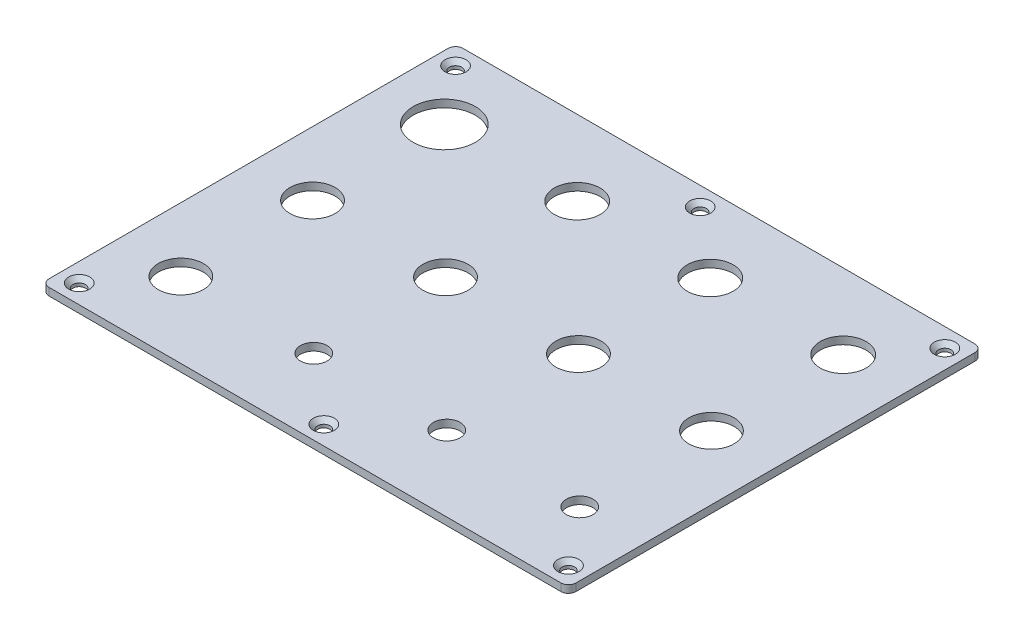
from build123d import *

# Parameters (mm, degrees)
BOTTOM_PLATE_W                       = 140
BOTTOM_PLATE_H                       = 110
BOTTOM_PLATE_EXT_DEPTH               = 2
MIDDLE_ROW_R                         = 6
MIDDLE_ROW_CUT_DEPTH                 = 179.056170912
TOP_ROW_R                            = 8.25
TOP_ROW_R_2                          = 6.1
TOP_ROW_CUT_DEPTH                    = 179.056170912
BOTTOM_ROW_R                         = 3.55
BOTTOM_ROW_R_2                       = 6
BOTTOM_ROW_CUT_DEPTH                 = 179.056170912
PLATE_SCREWS_R                       = 1.65
PLATE_SCREWS_CUT_DEPTH               = 179.056170912
PLATE_SCREW_HEAD_R                   = 2.8
PLATE_SCREW_HEAD_CUT_DEPTH           = 2
PLATE_SCREW_HEAD_CUT_DRAFT           = -45
PLATE_SCREW_HEAD_CUT_PROFILE_2_DEPTH = 2
PLATE_SCREW_HEAD_CUT_PROFILE_2_DRAFT = -45
PLATE_SCREW_HEAD_CUT_PROFILE_3_DEPTH = 2
PLATE_SCREW_HEAD_CUT_PROFILE_3_DRAFT = -45
PLATE_SCREW_HEAD_CUT_PROFILE_4_DEPTH = 2
PLATE_SCREW_HEAD_CUT_PROFILE_4_DRAFT = -45
PLATE_SCREW_HEAD_CUT_PROFILE_5_DEPTH = 2
PLATE_SCREW_HEAD_CUT_PROFILE_5_DRAFT = -45
PLATE_SCREW_HEAD_CUT_PROFILE_6_DEPTH = 2
PLATE_SCREW_HEAD_CUT_PROFILE_6_DRAFT = -45
FILLET1_R                            = 2
FILLET2_R                            = 2
FILLET3_R                            = 2
FILLET4_R                            = 2


with BuildPart() as part:
    # Bottom Plate → Bottom Plate EXT (new body)
    with BuildSketch(Plane(origin=(0, 0, 0), x_dir=(1, 0, 0), z_dir=(0, 1, 0))):
        with Locations((-70, 55)):
            Rectangle(BOTTOM_PLATE_W, BOTTOM_PLATE_H)
    extrude(amount=BOTTOM_PLATE_EXT_DEPTH)

    # Middle Row → Middle Row Cut (cut, through all)
    with BuildSketch(Plane(origin=(0, 2, 0), x_dir=(1, 0, 0), z_dir=(0, 1, 0))):
        with Locations((-123, 55)):
            Circle(MIDDLE_ROW_R)
        with Locations((-87.666666667, 55)):
            Circle(MIDDLE_ROW_R)
        with Locations((-52.333333333, 55)):
            Circle(MIDDLE_ROW_R)
        with Locations((-17, 55)):
            Circle(MIDDLE_ROW_R)
    extrude(amount=-MIDDLE_ROW_CUT_DEPTH, mode=Mode.SUBTRACT)

    # Top Row → Top Row Cut (cut, through all)
    with BuildSketch(Plane(origin=(0, 2, 0), x_dir=(1, 0, 0), z_dir=(0, 1, 0))):
        with Locations((-123, 90)):
            Circle(TOP_ROW_R)
        with Locations((-87.666666667, 90)):
            Circle(TOP_ROW_R_2)
        with Locations((-52.333333333, 90)):
            Circle(TOP_ROW_R_2)
        with Locations((-17, 90)):
            Circle(TOP_ROW_R_2)
    extrude(amount=-TOP_ROW_CUT_DEPTH, mode=Mode.SUBTRACT)

    # Bottom Row → Bottom Row Cut (cut, through all)
    with BuildSketch(Plane(origin=(0, 2, 0), x_dir=(1, 0, 0), z_dir=(0, 1, 0))):
        with Locations((-87.666666667, 20)):
            Circle(BOTTOM_ROW_R)
        with Locations((-52.333333333, 20)):
            Circle(BOTTOM_ROW_R)
        with Locations((-17, 20)):
            Circle(BOTTOM_ROW_R)
        with Locations((-123, 20)):
            Circle(BOTTOM_ROW_R_2)
    extrude(amount=-BOTTOM_ROW_CUT_DEPTH, mode=Mode.SUBTRACT)

    # Plate Screws → Plate Screws Cut (cut, through all)
    with BuildSketch(Plane(origin=(0, 2, 0), x_dir=(1, 0, 0), z_dir=(0, 1, 0))):
        with Locations((-135, 105)):
            Circle(PLATE_SCREWS_R)
        with Locations((-5, 105)):
            Circle(PLATE_SCREWS_R)
        with Locations((-5, 5)):
            Circle(PLATE_SCREWS_R)
        with Locations((-135, 5)):
            Circle(PLATE_SCREWS_R)
        with Locations((-70, 105)):
            Circle(PLATE_SCREWS_R)
        with Locations((-70, 5)):
            Circle(PLATE_SCREWS_R)
    extrude(amount=-PLATE_SCREWS_CUT_DEPTH, mode=Mode.SUBTRACT)


with BuildPart() as plate_screw_head_cut_tool:
    # Plate Screw Head → Plate Screw Head Cut (with draft: the straight prism first)
    with BuildSketch(Plane(origin=(0, 2, 0), x_dir=(1, 0, 0), z_dir=(0, 1, 0))):
        with Locations((-135, 105)):
            Circle(PLATE_SCREW_HEAD_R)
    extrude(amount=-PLATE_SCREW_HEAD_CUT_DEPTH)
    # Plate Screw Head Cut: the draft: its side faces are tilted about the plane it starts from
    plate_screw_head_cut_sides = [plate_screw_head_cut_tool.faces().sort_by_distance(p)[0] for p in [
        (-137.8, 1, -105),
    ]]
    draft(plate_screw_head_cut_sides, Plane(origin=(0, 2, 0), x_dir=(1, 0, 0), z_dir=(0, 1, 0)), PLATE_SCREW_HEAD_CUT_DRAFT)


with BuildPart() as part_1:
    add(part.part)

    # Plate Screw Head Cut: cut by plate_screw_head_cut_tool
    add(plate_screw_head_cut_tool.part, mode=Mode.SUBTRACT)


with BuildPart() as plate_screw_head_cut_profile_2_tool:
    # Plate Screw Head → Plate Screw Head Cut profile 2 (with draft: the straight prism first)
    with BuildSketch(Plane(origin=(0, 2, 0), x_dir=(1, 0, 0), z_dir=(0, 1, 0))):
        with Locations((-5, 105)):
            Circle(PLATE_SCREW_HEAD_R)
    extrude(amount=-PLATE_SCREW_HEAD_CUT_PROFILE_2_DEPTH)
    # Plate Screw Head Cut profile 2: the draft: its side faces are tilted about the plane it starts from
    plate_screw_head_cut_profile_2_sides = [plate_screw_head_cut_profile_2_tool.faces().sort_by_distance(p)[0] for p in [
        (-7.8, 1, -105),
    ]]
    draft(plate_screw_head_cut_profile_2_sides, Plane(origin=(0, 2, 0), x_dir=(1, 0, 0), z_dir=(0, 1, 0)), PLATE_SCREW_HEAD_CUT_PROFILE_2_DRAFT)


with BuildPart() as part_2:
    add(part_1.part)

    # Plate Screw Head Cut profile 2: cut by plate_screw_head_cut_profile_2_tool
    add(plate_screw_head_cut_profile_2_tool.part, mode=Mode.SUBTRACT)


with BuildPart() as plate_screw_head_cut_profile_3_tool:
    # Plate Screw Head → Plate Screw Head Cut profile 3 (with draft: the straight prism first)
    with BuildSketch(Plane(origin=(0, 2, 0), x_dir=(1, 0, 0), z_dir=(0, 1, 0))):
        with Locations((-5, 5)):
            Circle(PLATE_SCREW_HEAD_R)
    extrude(amount=-PLATE_SCREW_HEAD_CUT_PROFILE_3_DEPTH)
    # Plate Screw Head Cut profile 3: the draft: its side faces are tilted about the plane it starts from
    plate_screw_head_cut_profile_3_sides = [plate_screw_head_cut_profile_3_tool.faces().sort_by_distance(p)[0] for p in [
        (-7.8, 1, -5),
    ]]
    draft(plate_screw_head_cut_profile_3_sides, Plane(origin=(0, 2, 0), x_dir=(1, 0, 0), z_dir=(0, 1, 0)), PLATE_SCREW_HEAD_CUT_PROFILE_3_DRAFT)


with BuildPart() as part_3:
    add(part_2.part)

    # Plate Screw Head Cut profile 3: cut by plate_screw_head_cut_profile_3_tool
    add(plate_screw_head_cut_profile_3_tool.part, mode=Mode.SUBTRACT)


with BuildPart() as plate_screw_head_cut_profile_4_tool:
    # Plate Screw Head → Plate Screw Head Cut profile 4 (with draft: the straight prism first)
    with BuildSketch(Plane(origin=(0, 2, 0), x_dir=(1, 0, 0), z_dir=(0, 1, 0))):
        with Locations((-135, 5)):
            Circle(PLATE_SCREW_HEAD_R)
    extrude(amount=-PLATE_SCREW_HEAD_CUT_PROFILE_4_DEPTH)
    # Plate Screw Head Cut profile 4: the draft: its side faces are tilted about the plane it starts from
    plate_screw_head_cut_profile_4_sides = [plate_screw_head_cut_profile_4_tool.faces().sort_by_distance(p)[0] for p in [
        (-137.8, 1, -5),
    ]]
    draft(plate_screw_head_cut_profile_4_sides, Plane(origin=(0, 2, 0), x_dir=(1, 0, 0), z_dir=(0, 1, 0)), PLATE_SCREW_HEAD_CUT_PROFILE_4_DRAFT)


with BuildPart() as part_4:
    add(part_3.part)

    # Plate Screw Head Cut profile 4: cut by plate_screw_head_cut_profile_4_tool
    add(plate_screw_head_cut_profile_4_tool.part, mode=Mode.SUBTRACT)


with BuildPart() as plate_screw_head_cut_profile_5_tool:
    # Plate Screw Head → Plate Screw Head Cut profile 5 (with draft: the straight prism first)
    with BuildSketch(Plane(origin=(0, 2, 0), x_dir=(1, 0, 0), z_dir=(0, 1, 0))):
        with Locations((-70, 105)):
            Circle(PLATE_SCREW_HEAD_R)
    extrude(amount=-PLATE_SCREW_HEAD_CUT_PROFILE_5_DEPTH)
    # Plate Screw Head Cut profile 5: the draft: its side faces are tilted about the plane it starts from
    plate_screw_head_cut_profile_5_sides = [plate_screw_head_cut_profile_5_tool.faces().sort_by_distance(p)[0] for p in [
        (-72.8, 1, -105),
    ]]
    draft(plate_screw_head_cut_profile_5_sides, Plane(origin=(0, 2, 0), x_dir=(1, 0, 0), z_dir=(0, 1, 0)), PLATE_SCREW_HEAD_CUT_PROFILE_5_DRAFT)


with BuildPart() as part_5:
    add(part_4.part)

    # Plate Screw Head Cut profile 5: cut by plate_screw_head_cut_profile_5_tool
    add(plate_screw_head_cut_profile_5_tool.part, mode=Mode.SUBTRACT)


with BuildPart() as plate_screw_head_cut_profile_6_tool:
    # Plate Screw Head → Plate Screw Head Cut profile 6 (with draft: the straight prism first)
    with BuildSketch(Plane(origin=(0, 2, 0), x_dir=(1, 0, 0), z_dir=(0, 1, 0))):
        with Locations((-70, 5)):
            Circle(PLATE_SCREW_HEAD_R)
    extrude(amount=-PLATE_SCREW_HEAD_CUT_PROFILE_6_DEPTH)
    # Plate Screw Head Cut profile 6: the draft: its side faces are tilted about the plane it starts from
    plate_screw_head_cut_profile_6_sides = [plate_screw_head_cut_profile_6_tool.faces().sort_by_distance(p)[0] for p in [
        (-72.8, 1, -5),
    ]]
    draft(plate_screw_head_cut_profile_6_sides, Plane(origin=(0, 2, 0), x_dir=(1, 0, 0), z_dir=(0, 1, 0)), PLATE_SCREW_HEAD_CUT_PROFILE_6_DRAFT)


with BuildPart() as part_6:
    add(part_5.part)

    # Plate Screw Head Cut profile 6: cut by plate_screw_head_cut_profile_6_tool
    add(plate_screw_head_cut_profile_6_tool.part, mode=Mode.SUBTRACT)

    # Fillet1
    fillet1_edges = [part_6.edges().sort_by_distance(p)[0] for p in [
        (-140, 1, -110),
    ]]
    fillet(fillet1_edges, radius=FILLET1_R)

    # Fillet2
    fillet2_edges = [part_6.edges().sort_by_distance(p)[0] for p in [
        (0, 1, -110),
    ]]
    fillet(fillet2_edges, radius=FILLET2_R)

    # Fillet3
    fillet3_edges = [part_6.edges().sort_by_distance(p)[0] for p in [
        (0, 1, 0),
    ]]
    fillet(fillet3_edges, radius=FILLET3_R)

    # Fillet4
    fillet4_edges = [part_6.edges().sort_by_distance(p)[0] for p in [
        (-140, 1, 0),
    ]]
    fillet(fillet4_edges, radius=FILLET4_R)


solid = part_6.part
